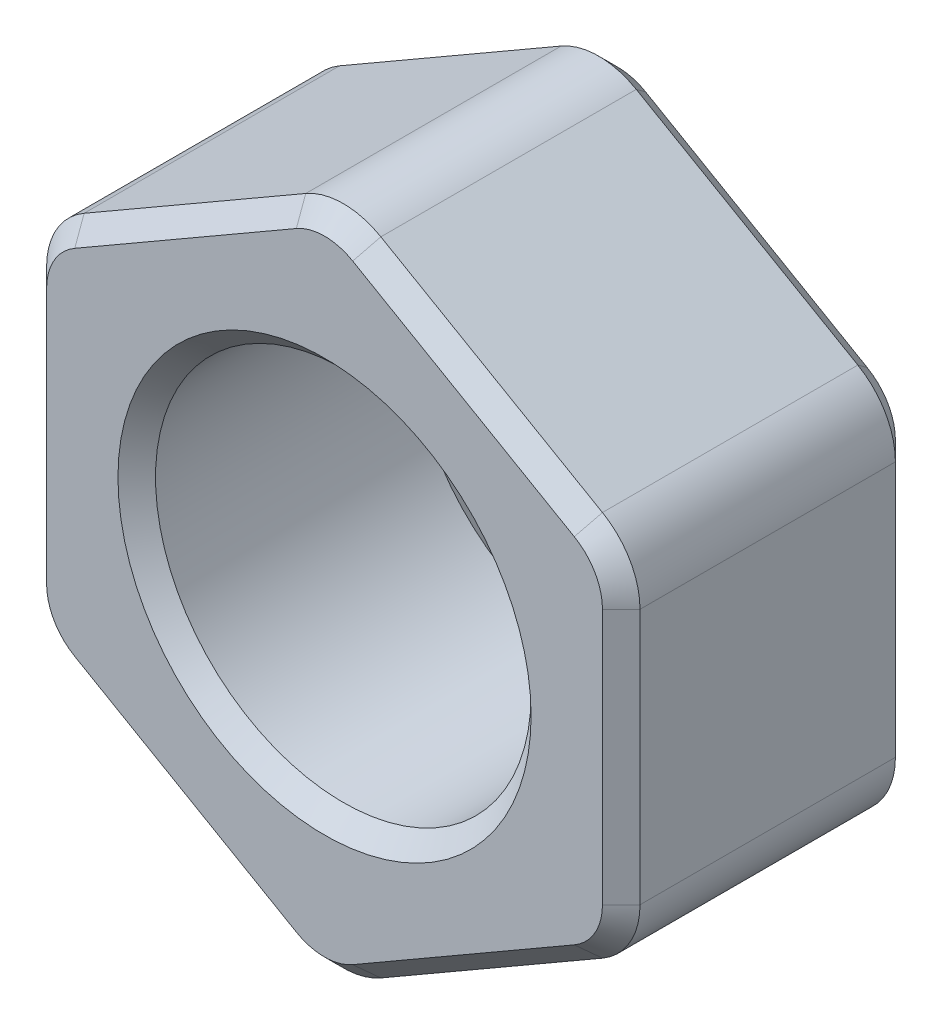
from build123d import *

# Parameters (mm, degrees)
SKIZZE1_R                       = 2.5
AUFSATZ_LINEAR_AUSTRAGEN1_DEPTH = 3.9
VERRUNDUNG1_R                   = 1
FASE1_SIZE                      = 0.25


with BuildPart() as part:
    # Skizze1 → Aufsatz-Linear austragen1 (new body)
    with BuildSketch(Plane.XY):
        Polygon((0, 4.561067127), (3.95, 2.280533563), (3.95, -2.280533563), (0, -4.561067127), (-3.95, -2.280533563), (-3.95, 2.280533563), align=None)
        Circle(SKIZZE1_R, mode=Mode.SUBTRACT)
    extrude(amount=AUFSATZ_LINEAR_AUSTRAGEN1_DEPTH)

    # Verrundung1
    verrundung1_edges = [part.edges().sort_by_distance(p)[0] for p in [
        (3.95, 2.280533563, 1.95),
        (3.95, -2.280533563, 1.95),
        (0, -4.561067127, 1.95),
        (-3.95, -2.280533563, 1.95),
        (-3.95, 2.280533563, 1.95),
        (0, 4.561067127, 1.95),
    ]]
    fillet(verrundung1_edges, radius=VERRUNDUNG1_R)

    # Fase1
    fase1_edges = [part.edges().sort_by_distance(p)[0] for p in [
        (-2.5, 0, 0),
        (-2.5, 0, 3.9),
        (-1.975, -3.420800345, 0),
        (0, -4.406366588, 0),
        (-3.816025404, -2.203183294, 0),
        (1.975, -3.420800345, 0),
        (-3.95, 0, 0),
        (3.816025404, -2.203183294, 0),
        (-3.816025404, 2.203183294, 0),
        (3.95, 0, 0),
        (-1.975, 3.420800345, 0),
        (3.816025404, 2.203183294, 0),
        (0, 4.406366588, 0),
        (1.975, 3.420800345, 0),
        (-1.975, -3.420800345, 3.9),
        (0, -4.406366588, 3.9),
        (-3.816025404, -2.203183294, 3.9),
        (1.975, -3.420800345, 3.9),
        (-3.95, 0, 3.9),
        (3.816025404, -2.203183294, 3.9),
        (-3.816025404, 2.203183294, 3.9),
        (3.95, 0, 3.9),
        (-1.975, 3.420800345, 3.9),
        (3.816025404, 2.203183294, 3.9),
        (0, 4.406366588, 3.9),
        (1.975, 3.420800345, 3.9),
    ]]
    chamfer(fase1_edges, length=FASE1_SIZE)


solid = part.part
